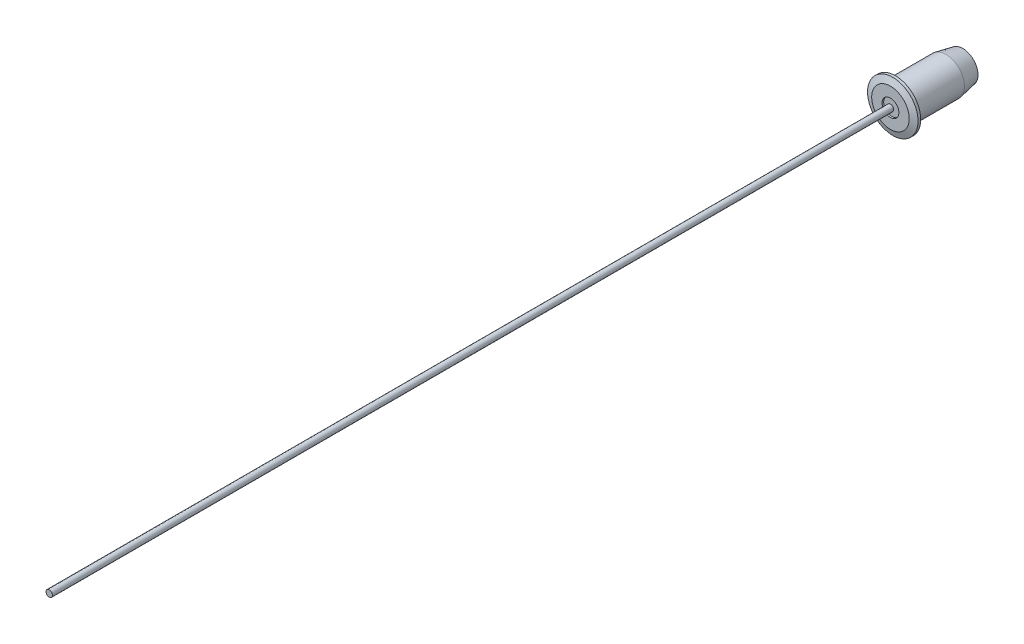
from build123d import *

# Parameters (mm, degrees)
SKETCH1_R           = 7.5
BOSS_EXTRUDE1_DEPTH = 1.5
CHAMFER2_SIZE       = 0.7
CHAMFER2_SIZE2      = 1.923234194
SKETCH2_R           = 5.5
BOSS_EXTRUDE2_DEPTH = 20
CHAMFER3_SIZE       = 5
CHAMFER3_SIZE2      = 0.971901546
SKETCH3_R           = 2.5
CUT_EXTRUDE1_DEPTH  = 0.5
SKETCH5_R           = 0.954691788
BOSS_EXTRUDE4_DEPTH = 250


with BuildPart() as part:
    # Sketch1 → Boss-Extrude1 (new body)
    with BuildSketch(Plane.XY):
        Circle(SKETCH1_R)
    extrude(amount=BOSS_EXTRUDE1_DEPTH)

    # Chamfer2
    chamfer2_edges = [part.edges().sort_by_distance(p)[0] for p in [
        (-7.5, 0, 1.5),
    ]]
    chamfer2_side = [part.faces().sort_by_distance(p)[0] for p in [
        (-7.5, 0, 0.75),
    ]]
    chamfer(chamfer2_edges, length=CHAMFER2_SIZE, length2=CHAMFER2_SIZE2, reference=chamfer2_side[0])

    # Sketch2 → Boss-Extrude2 (add)
    with BuildSketch(Plane(origin=(0, 0, 0), x_dir=(-1, 0, 0), z_dir=(0, 0, -1))):
        Circle(SKETCH2_R)
    extrude(amount=BOSS_EXTRUDE2_DEPTH)

    # Chamfer3
    chamfer3_edges = [part.edges().sort_by_distance(p)[0] for p in [
        (5.5, 0, -20),
    ]]
    chamfer3_side = [part.faces().sort_by_distance(p)[0] for p in [
        (5.5, 0, -10),
    ]]
    chamfer(chamfer3_edges, length=CHAMFER3_SIZE, length2=CHAMFER3_SIZE2, reference=chamfer3_side[0])

    # Sketch3 → Cut-Extrude1 (cut)
    with BuildSketch(Plane.XY.offset(1.5)):
        Circle(SKETCH3_R)
    extrude(amount=-CUT_EXTRUDE1_DEPTH, mode=Mode.SUBTRACT)


with BuildPart() as body_2:
    # Sketch5 → Boss-Extrude4 (new body)
    with BuildSketch(Plane.XY.offset(1.5)):
        Circle(SKETCH5_R)
    extrude(amount=BOSS_EXTRUDE4_DEPTH)


solid = Compound([part.part, body_2.part])
